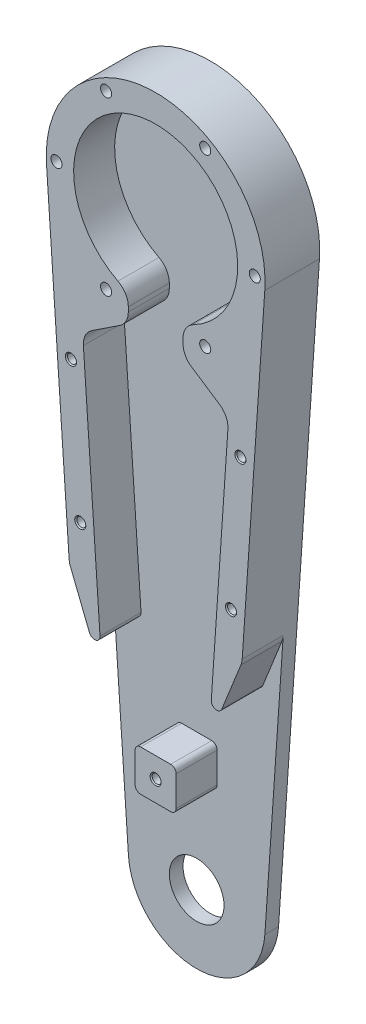
from build123d import *
from build123d.topology import SkipClean

# Parameters (mm, degrees)
SKETCH1_R                       = 40
SKETCH1_R_2                     = 30
BOSS_EXTRUDE1_DEPTH             = 5
M4X0_7_TAPPED_HOLE1_D           = 3.3
M4X0_7_TAPPED_HOLE1_CSINK_D     = 4.05
M4X0_7_TAPPED_HOLE1_CSINK_ANGLE = 90
CIRPATTERN1_COUNT               = 6
SKETCH14_R                      = 10
BOSS_EXTRUDE5_DEPTH             = 5
BOSS_EXTRUDE7_START             = 15
SKETCH15_R                      = 2.025
SKETCH15_W                      = 15
SKETCH15_H                      = 15
BOSS_EXTRUDE7_DEPTH             = 15
FILLET3_R                       = 2
FILLET4_R                       = 7
M4X0_7_TAPPED_HOLE2_D           = 3.3
M4X0_7_TAPPED_HOLE2_CSINK_D     = 4.05
M4X0_7_TAPPED_HOLE2_CSINK_ANGLE = 90
SKETCH1_3_R                     = 30
BOSS_EXTRUDE8_DEPTH             = 5


with BuildPart() as part:
    # Sketch1 → Boss-Extrude1 (new body)
    with BuildSketch(Plane.XY):
        Circle(SKETCH1_R)
        Circle(SKETCH1_R_2, mode=Mode.SUBTRACT)
    extrude(amount=-BOSS_EXTRUDE1_DEPTH)

    # M4x0.7 Tapped Hole1 (through all)
    with Locations(Plane.XY):
        with Locations((36.25, 0)):
            m4x0_7_tapped_hole1 = CounterSinkHole(M4X0_7_TAPPED_HOLE1_D / 2, M4X0_7_TAPPED_HOLE1_CSINK_D / 2, counter_sink_angle=M4X0_7_TAPPED_HOLE1_CSINK_ANGLE)

    # CirPattern1: M4x0.7 Tapped Hole1 ×6 about axis
    cirpattern1_axis = Axis((0, 0, 0), (0, 0, 1))
    for i in range(1, CIRPATTERN1_COUNT):
        add(m4x0_7_tapped_hole1.rotate(cirpattern1_axis, i * 360 / CIRPATTERN1_COUNT), mode=Mode.SUBTRACT)

    # Sketch14 → Boss-Extrude5 (add)
    with BuildSketch(Plane.XY):
        with BuildLine():
            ThreePointArc((39.906916487, -2.727272727), (0, -40), (-39.906916487, -2.727272727))
            Line((-39.906916487, -2.727272727), (-24.941822804, -221.704545455))
            ThreePointArc((-24.941822804, -221.704545455), (0, -245), (24.941822804, -221.704545455))
            Line((24.941822804, -221.704545455), (39.906916487, -2.727272727))
        make_face()
        with Locations((0, -220)):
            Circle(SKETCH14_R, mode=Mode.SUBTRACT)
    extrude(amount=-BOSS_EXTRUDE5_DEPTH)

    # Sketch15 → Boss-Extrude7 (add)
    # profile 1 of 2: a face of its own
    with SkipClean():  # the faces are left unmerged after this step: merging them gives an invalid solid
        with BuildSketch(Plane.XY.offset(BOSS_EXTRUDE7_START)):
            with BuildLine():
                Line((-39.906916487, -2.727272727), (-31.570605203, -124.708648069))
                Line((-31.570605203, -124.708648069), (-19.477143205, -155))
                Line((-19.477143205, -155), (-26.701678828, -49.28672208))
                Line((-26.701678828, -49.28672208), (-10, -38.284271247))
                Line((-10, -38.284271247), (-10, -28.284271247))
                ThreePointArc((-10, -28.284271247), (0, 30), (10, -28.284271247))
                Line((10, -28.284271247), (10, -38.284271247))
                Line((10, -38.284271247), (26.701678828, -49.28672208))
                Line((26.701678828, -49.28672208), (19.477143205, -155))
                Line((19.477143205, -155), (31.570605203, -124.708648069))
                Line((31.570605203, -124.708648069), (39.906916487, -2.727272727))
                ThreePointArc((39.906916487, -2.727272727), (0, 40), (-39.906916487, -2.727272727))
            make_face()
            with Locations((-18.125, -31.393420887)):
                Circle(SKETCH15_R, mode=Mode.SUBTRACT)
            with Locations((-36.25, 0)):
                Circle(SKETCH15_R, mode=Mode.SUBTRACT)
            with Locations((-18.125, 31.393420887)):
                Circle(SKETCH15_R, mode=Mode.SUBTRACT)
            with Locations((36.25, 0)):
                Circle(SKETCH15_R, mode=Mode.SUBTRACT)
            with Locations((18.125, -31.393420887)):
                Circle(SKETCH15_R, mode=Mode.SUBTRACT)
            with Locations((18.125, 31.393420887)):
                Circle(SKETCH15_R, mode=Mode.SUBTRACT)
        # profile 2 of 2: a face of its own
        with BuildSketch(Plane.XY.offset(BOSS_EXTRUDE7_START)):
            with Locations((0, -177.5)):
                Rectangle(SKETCH15_W, SKETCH15_H)
        extrude(amount=-BOSS_EXTRUDE7_DEPTH)

    # Fillet3
    fillet3_edges = [part.edges().sort_by_distance(p)[0] for p in [
        (7.5, -170, 7.5),
        (-7.5, -170, 7.5),
        (-7.5, -185, 7.5),
        (7.5, -185, 7.5),
        (-19.477143205, -155, 7.5),
        (19.477143205, -155, 7.5),
    ]]
    fillet(fillet3_edges, radius=FILLET3_R)

    # Fillet4
    # the kernel refuses this fillet: 7 mm, written as the material it adds along each edge
    with BuildSketch(Plane(origin=(-26.701678828, -49.28672208, 15), x_dir=(0.8350839414170256, 0.5501225416099633, 0), z_dir=(0, 0, -1))) as fillet4_piece_1_section:
        with BuildLine():
            CenterArc((FILLET4_R * 0.583582124754, FILLET4_R), FILLET4_R, 209.465856716, 60.534143284)
            Line((-FILLET4_R * 0.287066858092, FILLET4_R * 0.508095183324), (0, 0))
            Line((0, 0), (FILLET4_R * 0.583582124754, 0))
        make_face()
    fillet4_piece_1 = extrude(amount=25.212687183, mode=Mode.PRIVATE)
    fillet4_piece_1 = split(fillet4_piece_1, bisect_by=Plane(origin=(-25.926798834, -49.670659835, -5), z_dir=(0, 0, 1)), keep=Keep.TOP, mode=Mode.PRIVATE)
    add(fillet4_piece_1)
    with BuildSketch(Plane(origin=(26.701678828, -49.28672208, 15), x_dir=(-0.06818181818181926, -0.9976729121658167, 0), z_dir=(0, 0, -1))) as fillet4_piece_2_section:
        with BuildLine():
            CenterArc((FILLET4_R * 0.583582124754, FILLET4_R), FILLET4_R, 209.465856716, 60.534143284)
            Line((-FILLET4_R * 0.287066858092, FILLET4_R * 0.508095183324), (0, 0))
            Line((0, 0), (FILLET4_R * 0.583582124754, 0))
        make_face()
    fillet4_piece_2 = extrude(amount=25.212687183, mode=Mode.PRIVATE)
    fillet4_piece_2 = split(fillet4_piece_2, bisect_by=Plane(origin=(25.926798834, -49.670659835, -5), z_dir=(0, 0, 1)), keep=Keep.TOP, mode=Mode.PRIVATE)
    add(fillet4_piece_2)
    # the kernel refuses this fillet: 7 mm, written as the material it takes off along each edge
    with BuildSketch(Plane(origin=(-31.570605203, -124.708648069, 17.748908315), x_dir=(-0.06818181818181737, 0.9976729121658168, 0), z_dir=(0, 0, -1)), Plane(origin=(31.570605203, -124.708648069, 17.748908315), x_dir=(-0.37078060844808275, -0.9287204856138737, 0), z_dir=(0, 0, -1))) as fillet4_2_piece_1:
        with BuildLine():
            CenterArc((FILLET4_R * 0.157080475159, FILLET4_R), FILLET4_R, 252.145796046, 17.854203954)
            Line((-FILLET4_R * 0.149515442954, FILLET4_R * 0.048160232499), (0, 0))
            Line((0, 0), (FILLET4_R * 0.157080475159, 0))
        make_face()
    extrude(amount=17.748908315, mode=Mode.SUBTRACT)
    with BuildSketch(Plane(origin=(-10, -38.284271247, 24.427621741), x_dir=(0, 1, 0), z_dir=(0, 0, -1)), Plane(origin=(10, -38.284271247, 24.427621741), x_dir=(0.8350839414170215, -0.5501225416099695, 0), z_dir=(0, 0, -1))) as fillet4_2_piece_2:
        with BuildLine():
            CenterArc((FILLET4_R * 0.538721242354, -FILLET4_R), FILLET4_R, 90, 56.624579759)
            Line((-FILLET4_R * 0.296362699063, -FILLET4_R * 0.44987745839), (0, 0))
            Line((0, 0), (FILLET4_R * 0.538721242354, 0))
        make_face()
    extrude(amount=24.427621741, mode=Mode.SUBTRACT)
    with BuildSketch(Plane(origin=(-10, -28.284271247, 26.447705507), x_dir=(-0.9176733218940842, 0.39733571986907557, 0), z_dir=(0, 0, -1))) as fillet4_2_piece_3:
        with BuildLine():
            CenterArc((4.60428033, -6.983451615), FILLET4_R, 93.940506137, 62.647767091)
            Line((-1.819432923, -4.202101576), (0, 0))
            ThreePointArc((0, 0), (2.061618058, -0.070921648), (4.123236116, 0))
        make_face()
    extrude(amount=26.447705507, mode=Mode.SUBTRACT)
    with BuildSketch(Plane(origin=(10, -28.284271247, 26.447705507), x_dir=(0, -1, 0), z_dir=(0, 0, -1))) as fillet4_2_piece_4:
        with BuildLine():
            CenterArc((4.579082203, -7), FILLET4_R, 90, 62.647767091)
            ThreePointArc((-1.63830899, -3.783783784), (-0.754071591, -1.920071596), (0, 0))
            Line((0, 0), (4.579082203, 0))
        make_face()
    extrude(amount=26.447705507, mode=Mode.SUBTRACT)

    # M4x0.7 Tapped Hole2 (through all)
    with Locations(Plane.XY.offset(15)):
        with Locations((0, -177.5), (-27.564144185, -110), (27.564144185, -110), (-30.981186852, -60), (30.981186852, -60)):
            CounterSinkHole(M4X0_7_TAPPED_HOLE2_D / 2, M4X0_7_TAPPED_HOLE2_CSINK_D / 2, counter_sink_angle=M4X0_7_TAPPED_HOLE2_CSINK_ANGLE)

    # Sketch1<3> → Boss-Extrude8 (add)
    with BuildSketch(Plane.XY):
        Circle(SKETCH1_3_R)
    extrude(amount=-BOSS_EXTRUDE8_DEPTH)


solid = part.part
